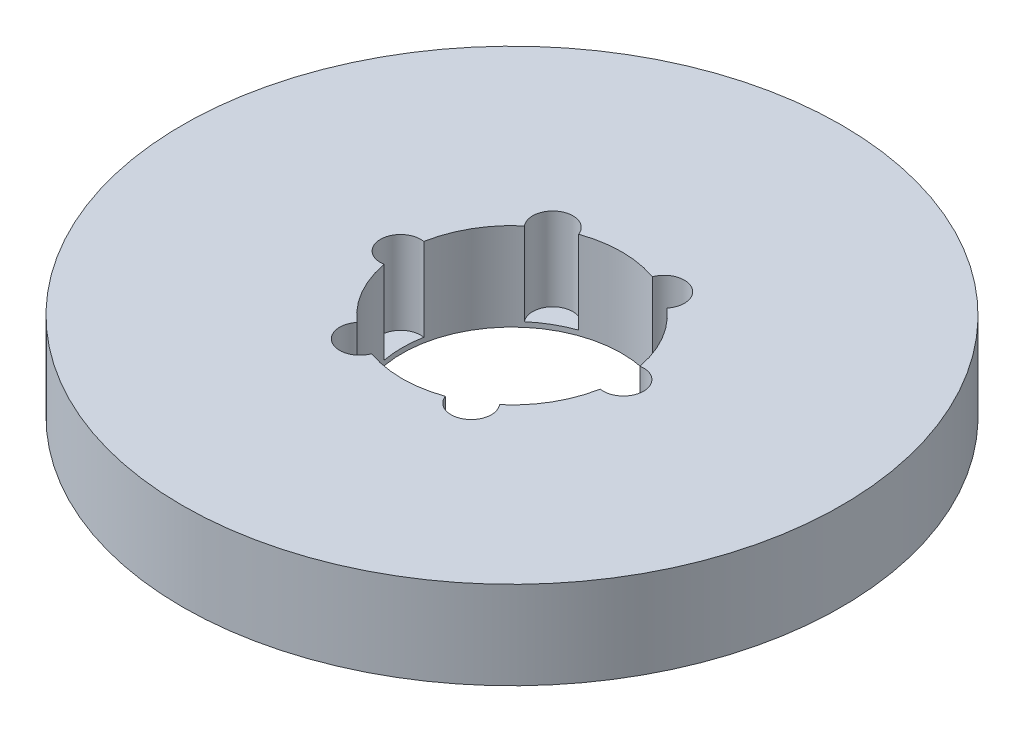
from build123d import *

# Parameters (mm, degrees)
SKETCH1_R           = 75
BOSS_EXTRUDE1_DEPTH = 20
SKETCH2_R           = 25
CUT_EXTRUDE1_DEPTH  = 108.935165725
SKETCH3_R           = 4.58268686
CUT_EXTRUDE2_DEPTH  = 18.889956424
CIRPATTERN1_COUNT   = 6


with BuildPart() as part:
    # Sketch1 → Boss-Extrude1 (new body)
    with BuildSketch(Plane(origin=(0, 0, 0), x_dir=(1, 0, 0), z_dir=(0, 1, 0))):
        Circle(SKETCH1_R)
    extrude(amount=BOSS_EXTRUDE1_DEPTH)

    # Sketch2 → Cut-Extrude1 (cut, through all)
    with BuildSketch(Plane(origin=(0, 0, 0), x_dir=(1, 0, 0), z_dir=(0, 1, 0))):
        Circle(SKETCH2_R)
    extrude(amount=CUT_EXTRUDE1_DEPTH, mode=Mode.SUBTRACT)

    # Sketch3 → Cut-Extrude2 (cut)
    with BuildSketch(Plane(origin=(0, 20, 0), x_dir=(1, 0, 0), z_dir=(0, 1, 0))):
        with Locations((-25.35655241, 0)):
            Circle(SKETCH3_R)
    cut_extrude2 = extrude(amount=-CUT_EXTRUDE2_DEPTH, mode=Mode.SUBTRACT)

    # CirPattern1: Cut-Extrude2 ×6 about axis
    cirpattern1_axis = Axis((0, 0, 0), (0, 1, 0))
    for i in range(1, CIRPATTERN1_COUNT):
        add(cut_extrude2.rotate(cirpattern1_axis, i * 360 / CIRPATTERN1_COUNT), mode=Mode.SUBTRACT)


solid = part.part
